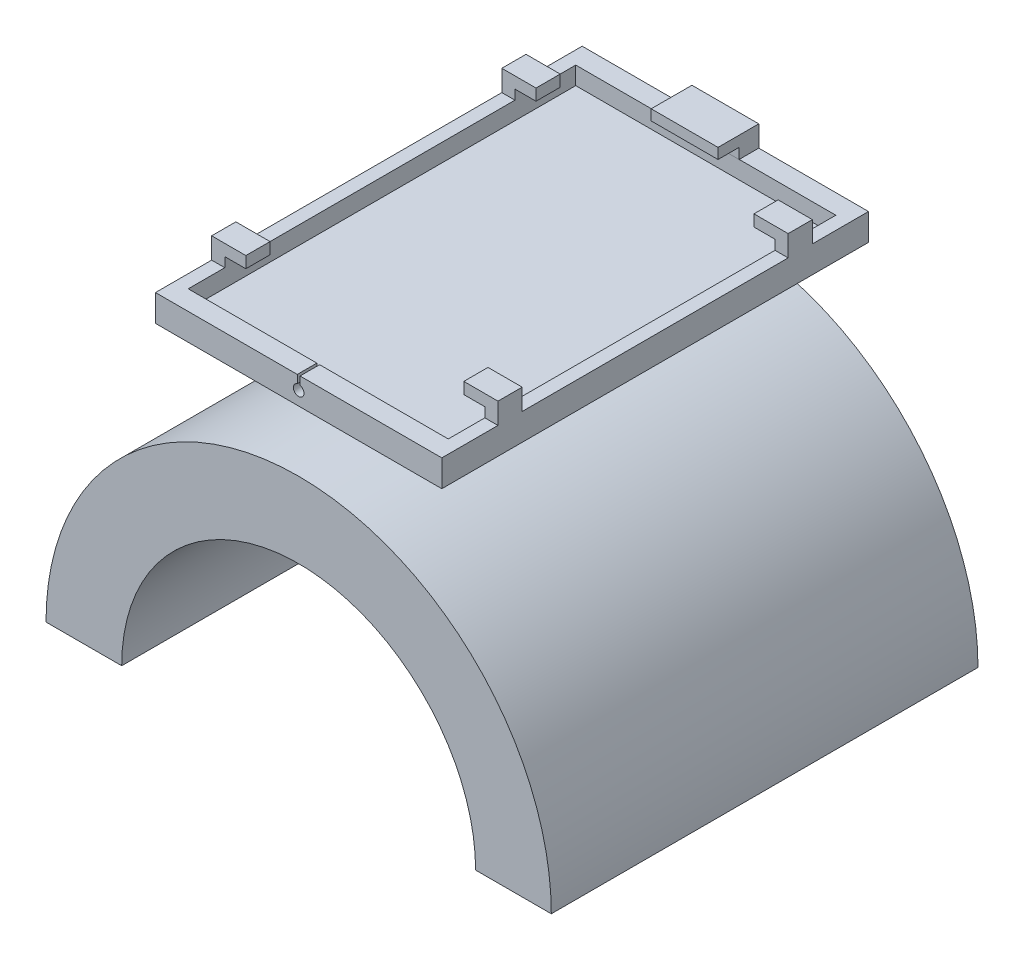
from build123d import *

# Parameters (mm, degrees)
SKETCH1_W                = 102
SKETCH1_H                = 152
BOSS_EXTRUDE1_DEPTH      = 3.175
SKETCH2_W                = 102
SKETCH2_H                = 152
SKETCH2_W_2              = 92.642768756
SKETCH2_H_2              = 138.055890694
BOSS_EXTRUDE2_DEPTH      = 6.35
CUT_EXTRUDE1_DEPTH       = 161.610477943
CUT_EXTRUDE1_DEPTH_BACK  = 7.175
SKETCH7_W                = 4.678615622
SKETCH7_H                = 8.620967169
BOSS_EXTRUDE3_DEPTH      = 7.5
SKETCH8_W                = 8.620967169
SKETCH8_H                = 4.074668009
BOSS_EXTRUDE4_DEPTH      = 7.5
MIRROR3_COPY_1_SKETCH_W  = 4.678615622
MIRROR3_COPY_1_SKETCH_H  = 8.620967169
MIRROR3_COPY_1_DEPTH     = 7.5
MIRROR3_COPY_2_SKETCH_W  = 8.620967169
MIRROR3_COPY_2_SKETCH_H  = 4.074668009
MIRROR3_COPY_2_DEPTH     = 7.5
MIRROR3_COPY_3_SKETCH_W  = 4.678615622
MIRROR3_COPY_3_SKETCH_H  = 8.620967169
MIRROR3_COPY_3_DEPTH     = 7.5
MIRROR3_COPY_4_SKETCH_W  = 8.620967169
MIRROR3_COPY_4_SKETCH_H  = 4.074668009
MIRROR3_COPY_4_DEPTH     = 7.5
SKETCH9_W                = 23.808255756
SKETCH9_H                = 7.018382857
BOSS_EXTRUDE5_DEPTH      = 7.5
SKETCH10_W               = 23.808255756
SKETCH10_H               = 3.75
BOSS_EXTRUDE6_DEPTH      = 7.5
BOSS_EXTRUDE8_DEPTH      = 76
BOSS_EXTRUDE8_DEPTH_BACK = 76


with BuildPart() as part:
    # Sketch1 → Boss-Extrude1 (new body)
    with BuildSketch(Plane(origin=(0, 0, 0), x_dir=(1, 0, 0), z_dir=(0, 1, 0))):
        Rectangle(SKETCH1_W, SKETCH1_H)
    extrude(amount=BOSS_EXTRUDE1_DEPTH)

    # Sketch2 → Boss-Extrude2 (add)
    with BuildSketch(Plane(origin=(0, 3.175, 0), x_dir=(1, 0, 0), z_dir=(0, 1, 0))):
        Rectangle(SKETCH2_W, SKETCH2_H)
        Rectangle(SKETCH2_W_2, SKETCH2_H_2, mode=Mode.SUBTRACT)
    extrude(amount=BOSS_EXTRUDE2_DEPTH)

    # Sketch5 → Cut-Extrude1 (cut, two sides: drawn at the far end of the back side and taken through both)
    with BuildSketch(Plane.XY.offset(76).offset(-CUT_EXTRUDE1_DEPTH_BACK)):
        with BuildLine():
            Line((-0.489433414, 9.525), (0.489433414, 9.525))
            Line((0.489433414, 9.525), (0.489433414, 6.660364011))
            ThreePointArc((0.489433414, 6.660364011), (0, 2.954695186), (-0.489433414, 6.660364011))
            Line((-0.489433414, 6.660364011), (-0.489433414, 9.525))
        make_face()
    extrude(amount=CUT_EXTRUDE1_DEPTH + CUT_EXTRUDE1_DEPTH_BACK, mode=Mode.SUBTRACT)

    # Sketch7 → Boss-Extrude3 (add)
    with BuildSketch(Plane(origin=(0, 9.525, 0), x_dir=(1, 0, 0), z_dir=(0, 1, 0))):
        with Locations((-48.660692189, -51.682411919)):
            Rectangle(SKETCH7_W, SKETCH7_H)
    boss_extrude3 = extrude(amount=BOSS_EXTRUDE3_DEPTH)

    # Sketch8 → Boss-Extrude4 (add)
    with BuildSketch(Plane(origin=(-46.321384378, 0, 0), x_dir=(0, 0, -1), z_dir=(1, 0, 0))):
        with Locations((-51.682411919, 14.987665996)):
            Rectangle(SKETCH8_W, SKETCH8_H)
    boss_extrude4 = extrude(amount=BOSS_EXTRUDE4_DEPTH)

    # Mirror1: Boss-Extrude3, Boss-Extrude4 across plane
    add(boss_extrude3.mirror(Plane(origin=(0, 0, 0), x_dir=(0, 0, 1), z_dir=(1, 0, 0))))
    add(boss_extrude4.mirror(Plane(origin=(0, 0, 0), x_dir=(0, 0, 1), z_dir=(1, 0, 0))))

    # Mirror3 copy 1 sketch → Mirror3 copy 1 (add)
    with BuildSketch(Plane(origin=(0, 9.525, 0), x_dir=(-1, 0, 0), z_dir=(0, 1, 0))):
        with Locations((-48.660692189, -51.682411919)):
            Rectangle(MIRROR3_COPY_1_SKETCH_W, MIRROR3_COPY_1_SKETCH_H)
    extrude(amount=MIRROR3_COPY_1_DEPTH)

    # Mirror3 copy 2 sketch → Mirror3 copy 2 (add)
    with BuildSketch(Plane.ZY.offset(-46.321384378)):
        with Locations((-51.682411919, 14.987665996)):
            Rectangle(MIRROR3_COPY_2_SKETCH_W, MIRROR3_COPY_2_SKETCH_H)
    extrude(amount=MIRROR3_COPY_2_DEPTH)

    # Mirror3 copy 3 sketch → Mirror3 copy 3 (add)
    with BuildSketch(Plane(origin=(0, 9.525, 0), x_dir=(1, 0, 0), z_dir=(0, 1, 0))):
        with Locations((-48.660692189, 51.682411919)):
            Rectangle(MIRROR3_COPY_3_SKETCH_W, MIRROR3_COPY_3_SKETCH_H)
    extrude(amount=MIRROR3_COPY_3_DEPTH)

    # Mirror3 copy 4 sketch → Mirror3 copy 4 (add)
    with BuildSketch(Plane(origin=(-46.321384378, 0, 0), x_dir=(0, 0, 1), z_dir=(1, 0, 0))):
        with Locations((-51.682411919, -14.987665996)):
            Rectangle(MIRROR3_COPY_4_SKETCH_W, MIRROR3_COPY_4_SKETCH_H)
    extrude(amount=MIRROR3_COPY_4_DEPTH)

    # Sketch9 → Boss-Extrude5 (add)
    with BuildSketch(Plane(origin=(0, 9.525, 0), x_dir=(1, 0, 0), z_dir=(0, 1, 0))):
        with Locations((0, 72.490808571)):
            Rectangle(SKETCH9_W, SKETCH9_H)
    extrude(amount=BOSS_EXTRUDE5_DEPTH)

    # Sketch10 → Boss-Extrude6 (add)
    with BuildSketch(Plane.XY.offset(-68.981617143)):
        with Locations((0, 15.15)):
            Rectangle(SKETCH10_W, SKETCH10_H)
    extrude(amount=BOSS_EXTRUDE6_DEPTH)


with BuildPart() as body_2:
    # Sketch12 → Boss-Extrude8 (new, two sides: drawn at the far end of the back side and taken through both)
    with BuildSketch(Plane.XY.offset(-BOSS_EXTRUDE8_DEPTH_BACK)):
        with BuildLine():
            Line((63.03626042, -111.63657585), (90, -111.63657585))
            ThreePointArc((90, -111.63657585), (0, -21.63657585), (-90, -111.63657585))
            Line((-90, -111.63657585), (-63.03626042, -111.63657585))
            ThreePointArc((-63.03626042, -111.63657585), (0, -48.60031543), (63.03626042, -111.63657585))
        make_face()
    boss_extrude8 = extrude(amount=BOSS_EXTRUDE8_DEPTH + BOSS_EXTRUDE8_DEPTH_BACK)

    # Mirror4: Boss-Extrude8 across plane
    add(boss_extrude8.mirror(Plane(origin=(0, 0, 0), x_dir=(0, 0, 1), z_dir=(1, 0, 0))))


solid = Compound([part.part, body_2.part])
